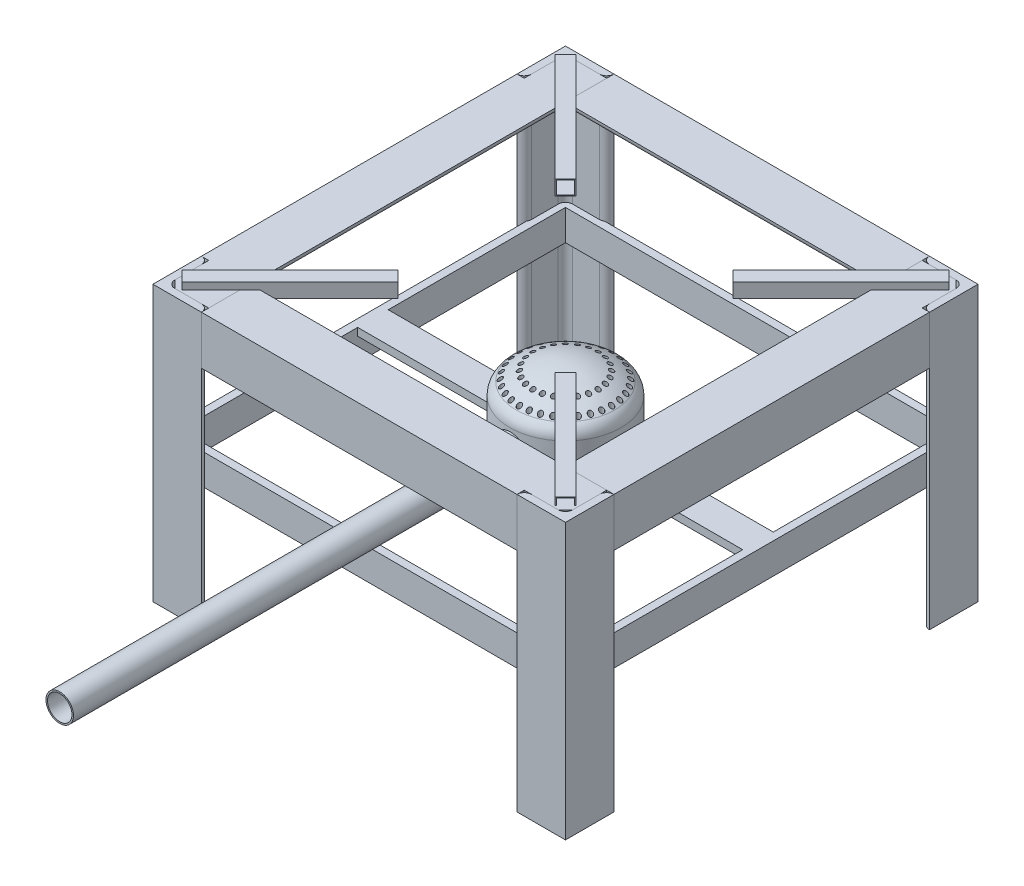
from build123d import *

# Parameters (mm, degrees)
L_START                                        = 31.75
L_ANGLE_L1_25X1_25X0_1875_1_DEPTH              = 206.5
L_START_2                                      = 238.25
L_ANGLE_L1_25X1_25X0_1875_1_2_DEPTH            = 26.9875
L_START_3                                      = 8.130096045
L_ANGLE_L1_25X1_25X0_1875_1_3_DEPTH            = 23.619903955
L_START_4                                      = 180.816042784
L_ANGLE_L1_25X1_25X0_1875_1_4_OUTLINE_W        = 10
L_ANGLE_L1_25X1_25X0_1875_1_4_OUTLINE_H        = 12
L_ANGLE_L1_25X1_25X0_1875_1_4_DEPTH            = 4.183957216
L_START_5                                      = 100.368069623
L_ANGLE_L1_25X1_25X0_1875_1_5_DEPTH            = 4.631930377
L_START_6                                      = -238.25
L_ANGLE_L1_25X1_25X0_1875_1_6_DEPTH            = 206.5
L_START_7                                      = -265.2375
L_ANGLE_L1_25X1_25X0_1875_1_7_DEPTH            = 260.475
L_START_8                                      = -185
L_ANGLE_L1_25X1_25X0_1875_1_8_OUTLINE_W        = 185.897211864
L_ANGLE_L1_25X1_25X0_1875_1_8_OUTLINE_H        = 12
L_ANGLE_L1_25X1_25X0_1875_1_8_DEPTH            = 4.183957216
L_START_9                                      = -19.083044257
L_ANGLE_L1_25X1_25X0_1875_1_9_OUTLINE_W        = 4.102788136
L_ANGLE_L1_25X1_25X0_1875_1_9_OUTLINE_H        = 12
L_ANGLE_L1_25X1_25X0_1875_1_9_DEPTH            = 38.166088514
L_ANGLE_L1_25X1_25X0_1875_1_10_DEPTH           = 206.5
L_ANGLE_L1_25X1_25X0_1875_1_11_DEPTH           = 26.9875
L_START_10                                     = -31.75
L_ANGLE_L1_25X1_25X0_1875_1_12_DEPTH           = 23.619903955
L_START_11                                     = 371.734873705
L_ANGLE_L1_25X1_25X0_1875_1_13_OUTLINE_W       = 10
L_ANGLE_L1_25X1_25X0_1875_1_13_OUTLINE_H       = 13
L_ANGLE_L1_25X1_25X0_1875_1_13_DEPTH           = 4.265126295
L_START_12                                     = 256.252642304
L_ANGLE_L1_25X1_25X0_1875_1_14_DEPTH           = 4.747357696
L_ANGLE_L1_25X1_25X0_1875_1_15_DEPTH           = 206.5
L_ANGLE_L1_25X1_25X0_1875_1_16_DEPTH           = 253.73980791
L_START_13                                     = -105
L_ANGLE_L1_25X1_25X0_1875_1_17_DEPTH           = 6
L_START_14                                     = 255
L_ANGLE_L1_25X1_25X0_1875_1_18_DEPTH           = 6
L_ANGLE_L1_25X1_25X0_1875_1_19_DEPTH           = 180
L_ANGLE_L1_25X1_25X0_1875_1_20_DEPTH           = 180
L_ANGLE_L1_25X1_25X0_1875_1_21_DEPTH           = 180
L_ANGLE_L1_25X1_25X0_1875_1_22_DEPTH           = 180
SKETCH131_W                                    = 9.525
SKETCH131_H                                    = 9.525
SKETCH131_W_2                                  = 8.4074
SKETCH131_H_2                                  = 8.4074
AL_TUBE_SQUARE_AL_TUBE_0_375_SQR_X_0_022_DEPTH = 100
SKETCH131_ON_SEGMENT_2_W                       = 9.525
SKETCH131_ON_SEGMENT_2_H                       = 9.525
SKETCH131_ON_SEGMENT_2_W_2                     = 8.4074
SKETCH131_ON_SEGMENT_2_H_2                     = 8.4074
AL_TUBE_SQUARE_AL_TUBE_0_375_SQR_X_0_2_DEPTH   = 100
SKETCH131_ON_SEGMENT_3_W                       = 9.525
SKETCH131_ON_SEGMENT_3_H                       = 9.525
SKETCH131_ON_SEGMENT_3_W_2                     = 8.4074
SKETCH131_ON_SEGMENT_3_H_2                     = 8.4074
AL_TUBE_SQUARE_AL_TUBE_0_375_SQR_X_0_3_DEPTH   = 100
SKETCH131_ON_SEGMENT_4_W                       = 9.525
SKETCH131_ON_SEGMENT_4_H                       = 9.525
SKETCH131_ON_SEGMENT_4_W_2                     = 8.4074
SKETCH131_ON_SEGMENT_4_H_2                     = 8.4074
AL_TUBE_SQUARE_AL_TUBE_0_375_SQR_X_0_4_DEPTH   = 100
SKETCH133_W                                    = 5
SKETCH133_H                                    = 20
BOSS_EXTRUDE1_DEPTH                            = 270
CIRPATTERN3_COUNT                              = 4
SKETCH135_W                                    = 20
SKETCH135_H                                    = 5
BOSS_EXTRUDE2_DEPTH                            = 260
SKETCH136_R                                    = 36.314503412
BOSS_EXTRUDE3_DEPTH                            = 24
DOME1_FACE_RADIUS                              = 36.314503412
DOME1_HEIGHT                                   = 14
FILLET1_R                                      = 10
BOSS_EXTRUDE4_START                            = -100
SKETCH137_R                                    = 9
BOSS_EXTRUDE4_DEPTH                            = 300
SHELL2_START                                   = -103
SHELL2_OUTLINE_R                               = 8
SHELL2_DEPTH                                   = 299
SKETCH138_R                                    = 1.5
CUT_EXTRUDE1_DEPTH                             = 24


with BuildPart() as part:
    # L angle L1.25X1.25X0.1875(1): read off the stored shape, not the designer's step
    # L angle L1.25X1.25X0.1875(1) outline → L angle L1.25X1.25X0.1875(1) (new body)
    with BuildSketch(Plane.YZ.offset(L_START)):
        with BuildLine():
            ThreePointArc((170.475, -4.7625), (173.842596045, -6.157403955), (175.2375, -9.525))
            Line((175.2375, -9.525), (175.2375, -26.99258))
            ThreePointArc((175.2375, -26.99258), (176.630916057, -30.356583943), (179.99492, -31.75))
            Line((179.99492, -31.75), (180, -31.75))
            Line((180, -31.75), (180, 0))
            Line((180, 0), (148.25, 0))
            Line((148.25, 0), (148.25, -0.00508))
            ThreePointArc((148.25, -0.00508), (149.643416057, -3.369083943), (153.00742, -4.7625))
            Line((153.00742, -4.7625), (170.475, -4.7625))
        make_face()
    extrude(amount=L_ANGLE_L1_25X1_25X0_1875_1_DEPTH)

    # L angle L1.25X1.25X0.1875_1 2 outline → L angle L1.25X1.25X0.1875_1 2 (add)
    with BuildSketch(Plane.YZ.offset(L_START_2)):
        with BuildLine():
            ThreePointArc((170.475, -4.7625), (173.842596045, -6.157403955), (175.2375, -9.525))
            Line((175.2375, -9.525), (175.2375, -26.99258))
            ThreePointArc((175.2375, -26.99258), (176.630916057, -30.356583943), (179.99492, -31.75))
            Line((179.99492, -31.75), (180, -31.75))
            Line((180, -31.75), (180, -4.7625))
            Line((180, -4.7625), (170.475, -4.7625))
        make_face()
    extrude(amount=L_ANGLE_L1_25X1_25X0_1875_1_2_DEPTH)

    # L angle L1.25X1.25X0.1875_1 3 outline → L angle L1.25X1.25X0.1875_1 3 (add)
    with BuildSketch(Plane.YZ.offset(L_START_3)):
        with BuildLine():
            Line((175.2375, -4.7625), (170.475, -4.7625))
            ThreePointArc((170.475, -4.7625), (173.842596045, -6.157403955), (175.2375, -9.525))
            Line((175.2375, -9.525), (175.2375, -4.7625))
        make_face()
    extrude(amount=L_ANGLE_L1_25X1_25X0_1875_1_3_DEPTH)

    # L angle L1.25X1.25X0.1875_1 4 outline → L angle L1.25X1.25X0.1875_1 4 (cut)
    with BuildSketch(Plane(origin=(0, 0, 0), x_dir=(0.707106781186552, 0, -0.7071067811865429), z_dir=(0.707106781186543, 0, 0.707106781186552)).offset(L_START_4)):
        with Locations((191, 175)):
            Rectangle(L_ANGLE_L1_25X1_25X0_1875_1_4_OUTLINE_W, L_ANGLE_L1_25X1_25X0_1875_1_4_OUTLINE_H)
    extrude(amount=L_ANGLE_L1_25X1_25X0_1875_1_4_DEPTH, mode=Mode.SUBTRACT)

    # L angle L1.25X1.25X0.1875_1 5 outline → L angle L1.25X1.25X0.1875_1 5 (cut)
    with BuildSketch(Plane(origin=(0, 0, 0), x_dir=(0.8164965809277261, -0.408248290463863, -0.408248290463863), z_dir=(0.5773502691896257, 0.5773502691896257, 0.5773502691896257)).offset(L_START_5)):
        Polygon((-59.8747149, 123.911624568), (-61.818997383, 127.279220614), (-59.8747149, 130.646816659), (-59.093454134, 132), (-64, 132), (-64, 122), (-58.771037941, 122), align=None)
    extrude(amount=L_ANGLE_L1_25X1_25X0_1875_1_5_DEPTH, mode=Mode.SUBTRACT)


with BuildPart() as body_2:
    # L angle L1.25X1.25X0.1875_1 6 outline → L angle L1.25X1.25X0.1875_1 6 (new body)
    with BuildSketch(Plane.XY.offset(L_START_6)):
        with BuildLine():
            Line((0, 180), (0, 148.25))
            Line((0, 148.25), (0.00508, 148.25))
            ThreePointArc((0.00508, 148.25), (3.369083943, 149.643416057), (4.7625, 153.00742))
            Line((4.7625, 153.00742), (4.7625, 170.475))
            ThreePointArc((4.7625, 170.475), (6.157403955, 173.842596045), (9.525, 175.2375))
            Line((9.525, 175.2375), (26.99258, 175.2375))
            ThreePointArc((26.99258, 175.2375), (30.356583943, 176.630916057), (31.75, 179.99492))
            Line((31.75, 179.99492), (31.75, 180))
            Line((31.75, 180), (0, 180))
        make_face()
    extrude(amount=L_ANGLE_L1_25X1_25X0_1875_1_6_DEPTH)

    # L angle L1.25X1.25X0.1875_1 7 outline → L angle L1.25X1.25X0.1875_1 7 (add)
    with BuildSketch(Plane.XY.offset(L_START_7)):
        with BuildLine():
            Line((31.75, 180), (4.7625, 180))
            Line((4.7625, 180), (4.7625, 170.475))
            ThreePointArc((4.7625, 170.475), (6.157403955, 173.842596045), (9.525, 175.2375))
            Line((9.525, 175.2375), (26.99258, 175.2375))
            ThreePointArc((26.99258, 175.2375), (30.356583943, 176.630916057), (31.75, 179.99492))
            Line((31.75, 179.99492), (31.75, 180))
        make_face()
    extrude(amount=L_ANGLE_L1_25X1_25X0_1875_1_7_DEPTH)

    # L angle L1.25X1.25X0.1875_1 8 outline → L angle L1.25X1.25X0.1875_1 8 (cut)
    with BuildSketch(Plane(origin=(0, 0, 0), x_dir=(0.7071067811865474, 0, -0.7071067811865477), z_dir=(0.7071067811865476, 0, 0.7071067811865476)).offset(L_START_8)):
        with Locations((103.051394068, 175)):
            Rectangle(L_ANGLE_L1_25X1_25X0_1875_1_8_OUTLINE_W, L_ANGLE_L1_25X1_25X0_1875_1_8_OUTLINE_H)
    extrude(amount=L_ANGLE_L1_25X1_25X0_1875_1_8_DEPTH, mode=Mode.SUBTRACT)

    # L angle L1.25X1.25X0.1875_1 9 outline → L angle L1.25X1.25X0.1875_1 9 (cut)
    with BuildSketch(Plane(origin=(0, 0, 0), x_dir=(0.7071067811865474, 0, -0.7071067811865477), z_dir=(0.7071067811865476, 0, 0.7071067811865476)).offset(L_START_9)):
        with Locations((8.051394068, 175)):
            Rectangle(L_ANGLE_L1_25X1_25X0_1875_1_9_OUTLINE_W, L_ANGLE_L1_25X1_25X0_1875_1_9_OUTLINE_H)
    extrude(amount=L_ANGLE_L1_25X1_25X0_1875_1_9_DEPTH, mode=Mode.SUBTRACT)


with BuildPart() as body_3:
    # L angle L1.25X1.25X0.1875_1 10 outline → L angle L1.25X1.25X0.1875_1 10 (new body)
    with BuildSketch(Plane.XY.offset(L_START_6)):
        with BuildLine():
            Line((270, 148.25), (270, 180))
            Line((270, 180), (238.25, 180))
            Line((238.25, 180), (238.25, 179.99492))
            ThreePointArc((238.25, 179.99492), (239.643416057, 176.630916057), (243.00742, 175.2375))
            Line((243.00742, 175.2375), (260.475, 175.2375))
            ThreePointArc((260.475, 175.2375), (263.842596045, 173.842596045), (265.2375, 170.475))
            Line((265.2375, 170.475), (265.2375, 153.00742))
            ThreePointArc((265.2375, 153.00742), (266.630916057, 149.643416057), (269.99492, 148.25))
            Line((269.99492, 148.25), (270, 148.25))
        make_face()
    extrude(amount=L_ANGLE_L1_25X1_25X0_1875_1_10_DEPTH)

    # L angle L1.25X1.25X0.1875_1 11 outline → L angle L1.25X1.25X0.1875_1 11 (add)
    with BuildSketch(Plane.XY.offset(L_START_7)):
        with BuildLine():
            Line((265.2375, 180), (238.25, 180))
            Line((238.25, 180), (238.25, 179.99492))
            ThreePointArc((238.25, 179.99492), (239.643416057, 176.630916057), (243.00742, 175.2375))
            Line((243.00742, 175.2375), (260.475, 175.2375))
            ThreePointArc((260.475, 175.2375), (263.842596045, 173.842596045), (265.2375, 170.475))
            Line((265.2375, 170.475), (265.2375, 180))
        make_face()
    extrude(amount=L_ANGLE_L1_25X1_25X0_1875_1_11_DEPTH)

    # L angle L1.25X1.25X0.1875_1 12 outline → L angle L1.25X1.25X0.1875_1 12 (add)
    with BuildSketch(Plane.XY.offset(L_START_10)):
        with BuildLine():
            Line((265.2375, 170.475), (265.2375, 175.2375))
            Line((265.2375, 175.2375), (260.475, 175.2375))
            ThreePointArc((260.475, 175.2375), (263.842596045, 173.842596045), (265.2375, 170.475))
        make_face()
    extrude(amount=L_ANGLE_L1_25X1_25X0_1875_1_12_DEPTH)

    # L angle L1.25X1.25X0.1875_1 13 outline → L angle L1.25X1.25X0.1875_1 13 (cut)
    with BuildSketch(Plane(origin=(0, 0, 0), x_dir=(0.707106781186545, 0, 0.70710678118655), z_dir=(0.70710678118655, 0, -0.707106781186545)).offset(L_START_11)):
        with Locations((0, -175.5)):
            Rectangle(L_ANGLE_L1_25X1_25X0_1875_1_13_OUTLINE_W, L_ANGLE_L1_25X1_25X0_1875_1_13_OUTLINE_H)
    extrude(amount=L_ANGLE_L1_25X1_25X0_1875_1_13_DEPTH, mode=Mode.SUBTRACT)

    # L angle L1.25X1.25X0.1875_1 14 outline → L angle L1.25X1.25X0.1875_1 14 (cut)
    with BuildSketch(Plane(origin=(0, 0, 0), x_dir=(0.8164965809277256, -0.40824829046386785, 0.4082482904638592), z_dir=(0.5773502691896265, 0.5773502691896314, -0.5773502691896192)).offset(L_START_12)):
        Polygon((143.0808196, -113.808836432), (141.136537117, -117.176432477), (136, -117.176432477), (136, -120), (145, -120), (145, -112), (144.125151801, -112), align=None)
    extrude(amount=L_ANGLE_L1_25X1_25X0_1875_1_14_DEPTH, mode=Mode.SUBTRACT)


with BuildPart() as body_4:
    # L angle L1.25X1.25X0.1875_1 15 outline → L angle L1.25X1.25X0.1875_1 15 (new body)
    with BuildSketch(Plane.YZ.offset(L_START)):
        with BuildLine():
            Line((148.25, -270), (180, -270))
            Line((180, -270), (180, -238.25))
            Line((180, -238.25), (179.99492, -238.25))
            ThreePointArc((179.99492, -238.25), (176.630916057, -239.643416057), (175.2375, -243.00742))
            Line((175.2375, -243.00742), (175.2375, -260.475))
            ThreePointArc((175.2375, -260.475), (173.842596045, -263.842596045), (170.475, -265.2375))
            Line((170.475, -265.2375), (153.00742, -265.2375))
            ThreePointArc((153.00742, -265.2375), (149.643416057, -266.630916057), (148.25, -269.99492))
            Line((148.25, -269.99492), (148.25, -270))
        make_face()
    extrude(amount=L_ANGLE_L1_25X1_25X0_1875_1_15_DEPTH)

    # L angle L1.25X1.25X0.1875_1 16 outline → L angle L1.25X1.25X0.1875_1 16 (add)
    with BuildSketch(Plane.YZ.offset(L_START_3)):
        with BuildLine():
            ThreePointArc((175.2375, -260.475), (173.842596045, -263.842596045), (170.475, -265.2375))
            Line((170.475, -265.2375), (175.2375, -265.2375))
            Line((175.2375, -265.2375), (175.2375, -260.475))
        make_face()
    extrude(amount=L_ANGLE_L1_25X1_25X0_1875_1_16_DEPTH)

    # L angle L1.25X1.25X0.1875_1 17 outline → L angle L1.25X1.25X0.1875_1 17 (cut)
    with BuildSketch(Plane(origin=(0, 0, 0), x_dir=(0.8164965809277253, 0.4082482904638598, -0.40824829046386774), z_dir=(0.5773502691896268, -0.5773502691896195, 0.5773502691896308)).offset(L_START_13)):
        Polygon((389.8214324, -59), (390.555830176, -60.272014261), (392.500112659, -63.639610307), (390.555830176, -67.007206352), (389.405290227, -69), (395, -69), (395, -59), align=None)
    extrude(amount=L_ANGLE_L1_25X1_25X0_1875_1_17_DEPTH, mode=Mode.SUBTRACT)

    # L angle L1.25X1.25X0.1875_1 18 outline → L angle L1.25X1.25X0.1875_1 18 (cut)
    with BuildSketch(Plane(origin=(0, 0, 0), x_dir=(0.8164965809277261, -0.408248290463863, 0.408248290463863), z_dir=(0.5773502691896257, 0.5773502691896257, -0.5773502691896257)).offset(L_START_14)):
        Polygon((-169.367355549, 59), (-170.101753325, 60.272014261), (-172.046035809, 63.639610307), (-170.101753325, 67.007206352), (-169, 68.915499087), (-169, 69), (-175, 69), (-175, 59), align=None)
    extrude(amount=L_ANGLE_L1_25X1_25X0_1875_1_18_DEPTH, mode=Mode.SUBTRACT)


with BuildPart() as body_5:
    # L angle L1.25X1.25X0.1875_1 19 outline → L angle L1.25X1.25X0.1875_1 19 (new body)
    with BuildSketch(Plane(origin=(0, 0, 0), x_dir=(1, 0, 0), z_dir=(0, 1, 0))):
        with BuildLine():
            Line((270, 238.25), (270, 270))
            Line((270, 270), (238.25, 270))
            Line((238.25, 270), (238.25, 269.99492))
            ThreePointArc((238.25, 269.99492), (239.643416057, 266.630916057), (243.00742, 265.2375))
            Line((243.00742, 265.2375), (260.475, 265.2375))
            ThreePointArc((260.475, 265.2375), (263.842596045, 263.842596045), (265.2375, 260.475))
            Line((265.2375, 260.475), (265.2375, 243.00742))
            ThreePointArc((265.2375, 243.00742), (266.630916057, 239.643416057), (269.99492, 238.25))
            Line((269.99492, 238.25), (270, 238.25))
        make_face()
    extrude(amount=L_ANGLE_L1_25X1_25X0_1875_1_19_DEPTH)


with BuildPart() as body_6:
    # L angle L1.25X1.25X0.1875_1 20 outline → L angle L1.25X1.25X0.1875_1 20 (new body)
    with BuildSketch(Plane(origin=(0, 0, 0), x_dir=(1, 0, 0), z_dir=(0, 1, 0))):
        with BuildLine():
            Line((31.75, 270), (0, 270))
            Line((0, 270), (0, 238.25))
            Line((0, 238.25), (0.00508, 238.25))
            ThreePointArc((0.00508, 238.25), (3.369083943, 239.643416057), (4.7625, 243.00742))
            Line((4.7625, 243.00742), (4.7625, 260.475))
            ThreePointArc((4.7625, 260.475), (6.157403955, 263.842596045), (9.525, 265.2375))
            Line((9.525, 265.2375), (26.99258, 265.2375))
            ThreePointArc((26.99258, 265.2375), (30.356583943, 266.630916057), (31.75, 269.99492))
            Line((31.75, 269.99492), (31.75, 270))
        make_face()
    extrude(amount=L_ANGLE_L1_25X1_25X0_1875_1_20_DEPTH)


with BuildPart() as body_7:
    # L angle L1.25X1.25X0.1875_1 21 outline → L angle L1.25X1.25X0.1875_1 21 (new body)
    with BuildSketch(Plane(origin=(0, 0, 0), x_dir=(1, 0, 0), z_dir=(0, 1, 0))):
        with BuildLine():
            Line((0, 0), (31.75, 0))
            Line((31.75, 0), (31.75, 0.00508))
            ThreePointArc((31.75, 0.00508), (30.356583943, 3.369083943), (26.99258, 4.7625))
            Line((26.99258, 4.7625), (9.525, 4.7625))
            ThreePointArc((9.525, 4.7625), (6.157403955, 6.157403955), (4.7625, 9.525))
            Line((4.7625, 9.525), (4.7625, 26.99258))
            ThreePointArc((4.7625, 26.99258), (3.369083943, 30.356583943), (0.00508, 31.75))
            Line((0.00508, 31.75), (0, 31.75))
            Line((0, 31.75), (0, 0))
        make_face()
    extrude(amount=L_ANGLE_L1_25X1_25X0_1875_1_21_DEPTH)



with BuildPart() as body_8:
    # L angle L1.25X1.25X0.1875_1 22 outline → L angle L1.25X1.25X0.1875_1 22 (new body)
    with BuildSketch(Plane(origin=(0, 0, 0), x_dir=(1, 0, 0), z_dir=(0, 1, 0))):
        with BuildLine():
            Line((238.25, 0), (270, 0))
            Line((270, 0), (270, 31.75))
            Line((270, 31.75), (269.99492, 31.75))
            ThreePointArc((269.99492, 31.75), (266.630916057, 30.356583943), (265.2375, 26.99258))
            Line((265.2375, 26.99258), (265.2375, 9.525))
            ThreePointArc((265.2375, 9.525), (263.842596045, 6.157403955), (260.475, 4.7625))
            Line((260.475, 4.7625), (243.00742, 4.7625))
            ThreePointArc((243.00742, 4.7625), (239.643416057, 3.369083943), (238.25, 0.00508))
            Line((238.25, 0.00508), (238.25, 0))
        make_face()
    extrude(amount=L_ANGLE_L1_25X1_25X0_1875_1_22_DEPTH)


with BuildPart() as body_9:
    # Sketch131 → Al tube square AL TUBE 0.375 SQR X 0.022 WALL(1) (new body)
    with BuildSketch(Plane(origin=(9.525, 180, -260.475), x_dir=(0.7071067811865434, 7.773490963901416e-15, -0.7071067811865518), z_dir=(0.7071067811865518, -7.770424377067959e-15, 0.7071067811865434))):
        Rectangle(SKETCH131_W, SKETCH131_H)
        Rectangle(SKETCH131_W_2, SKETCH131_H_2, mode=Mode.SUBTRACT)
    extrude(amount=AL_TUBE_SQUARE_AL_TUBE_0_375_SQR_X_0_022_DEPTH)


with BuildPart() as body_10:
    # Sketch131 on segment 2 (carried to segment 2) → Al tube square AL TUBE 0.375 SQR X 0 2 (new body)
    with BuildSketch(Plane(origin=(189.764321881, 180, -80.235678119), x_dir=(0.707106781, 0, -0.707106781), z_dir=(0.707106781, 0, 0.707106781))):
        Rectangle(SKETCH131_ON_SEGMENT_2_W, SKETCH131_ON_SEGMENT_2_H)
        Rectangle(SKETCH131_ON_SEGMENT_2_W_2, SKETCH131_ON_SEGMENT_2_H_2, mode=Mode.SUBTRACT)
    extrude(amount=AL_TUBE_SQUARE_AL_TUBE_0_375_SQR_X_0_2_DEPTH)


with BuildPart() as body_11:
    # Sketch131 on segment 3 (carried to segment 3) → Al tube square AL TUBE 0.375 SQR X 0 3 (new body)
    with BuildSketch(Plane(origin=(9.525, 180, -9.525), x_dir=(-0.707106781, 0, -0.707106781), z_dir=(0.707106781, 0, -0.707106781))):
        Rectangle(SKETCH131_ON_SEGMENT_3_W, SKETCH131_ON_SEGMENT_3_H)
        Rectangle(SKETCH131_ON_SEGMENT_3_W_2, SKETCH131_ON_SEGMENT_3_H_2, mode=Mode.SUBTRACT)
    extrude(amount=AL_TUBE_SQUARE_AL_TUBE_0_375_SQR_X_0_3_DEPTH)


with BuildPart() as body_12:
    # Sketch131 on segment 4 (carried to segment 4) → Al tube square AL TUBE 0.375 SQR X 0 4 (new body)
    with BuildSketch(Plane(origin=(260.475, 180, -260.475), x_dir=(0.707106781, 0, 0.707106781), z_dir=(-0.707106781, 0, 0.707106781))):
        Rectangle(SKETCH131_ON_SEGMENT_4_W, SKETCH131_ON_SEGMENT_4_H)
        Rectangle(SKETCH131_ON_SEGMENT_4_W_2, SKETCH131_ON_SEGMENT_4_H_2, mode=Mode.SUBTRACT)
    extrude(amount=AL_TUBE_SQUARE_AL_TUBE_0_375_SQR_X_0_4_DEPTH)


with BuildPart() as body_7_1:
    add(body_7.part)

    add(body_8.part)  # Boss-Extrude1 merges body 8
    # Sketch133 → Boss-Extrude1 (add)
    with BuildSketch(Plane(origin=(0, 0, 0), x_dir=(0, 0, -1), z_dir=(1, 0, 0))):
        with Locations((6.5, 87.521888974)):
            Rectangle(SKETCH133_W, SKETCH133_H)
    boss_extrude1 = extrude(amount=BOSS_EXTRUDE1_DEPTH)

    # CirPattern3: Boss-Extrude1 ×4 about axis
    cirpattern3_axis = Axis((135, 0, -135), (0, 1, 0))
    for i in range(1, CIRPATTERN3_COUNT):
        add(boss_extrude1.rotate(cirpattern3_axis, i * 360 / CIRPATTERN3_COUNT))

    # Sketch135 → Boss-Extrude2 (add)
    with BuildSketch(Plane(origin=(266, 0, 0), x_dir=(0, 0, -1), z_dir=(1, 0, 0))):
        with Locations((135, 95.021888974)):
            Rectangle(SKETCH135_W, SKETCH135_H)
    extrude(amount=-BOSS_EXTRUDE2_DEPTH)


with BuildPart() as body_12_2:
    # Sketch136 → Boss-Extrude3 (new body)
    with BuildSketch(Plane(origin=(0, 97.521888974, 0), x_dir=(1, 0, 0), z_dir=(0, 1, 0))):
        with Locations(Location((135, 135, 0), (0, 0, 270))):
            Circle(SKETCH136_R)
    extrude(amount=BOSS_EXTRUDE3_DEPTH)

    # Dome1: a dome of height H over a round flat face of radius A is a cap of a sphere of radius (A * A + H * H) / (2 * H)
    dome1_r = (DOME1_FACE_RADIUS * DOME1_FACE_RADIUS + DOME1_HEIGHT * DOME1_HEIGHT) / (2 * DOME1_HEIGHT)
    dome1_base = Plane((135, 121.521888974, -135), z_dir=(0, 1, 0))
    with Locations(dome1_base.offset(DOME1_HEIGHT - dome1_r)):
        dome1_ball = Sphere(dome1_r, mode=Mode.PRIVATE)
    add(split(dome1_ball, bisect_by=dome1_base, keep=Keep.TOP, mode=Mode.PRIVATE))

    # Fillet1
    fillet1_edges = [body_12_2.edges().sort_by_distance(p)[0] for p in [
        (135, 121.521888974, -171.314503412),
    ]]
    fillet(fillet1_edges, radius=FILLET1_R)

    # Shell1: read off the stored shape, not the designer's step
    # Shell1 outline → Shell1 (revolve, cut)
    with BuildSketch(Plane(origin=(135, 0, -135), x_dir=(1, 0, 0), z_dir=(0, 0, 1))):
        with BuildLine():
            Line((31.314503412, 97.521888974), (31.314503412, 116.810044322))
            ThreePointArc((31.314503412, 116.810044322), (30.782064585, 119.055238559), (29.298144547, 120.822261362))
            ThreePointArc((29.298144547, 120.822261362), (15.43100817, 128.033946271), (0, 130.521888974))
            Line((0, 130.521888974), (0, 97.521888974))
            Line((0, 97.521888974), (31.314503412, 97.521888974))
        make_face()
    revolve(axis=Axis((135, 0, -135), (0, 1, 0)), mode=Mode.SUBTRACT)

    # Sketch138 → Cut-Extrude1 (cut)
    with BuildSketch(Plane(origin=(0, 140, 0), x_dir=(1, 0, 0), z_dir=(0, 1, 0))):
        with Locations(Location((135, 165.191782037, 0), (0, 0, 217.718514705))):
            Circle(SKETCH138_R)
        with Locations(Location((140.89012448, 164.611655411, 0), (0, 0, 311.031485402))):
            Circle(SKETCH138_R)
        with Locations(Location((146.553894779, 162.893569474, 0), (0, 0, 299.781485402))):
            Circle(SKETCH138_R)
        with Locations(Location((151.773655382, 160.103549305, 0), (0, 0, 288.531485401))):
            Circle(SKETCH138_R)
        with Locations(Location((156.348813815, 156.348813815, 0), (0, 0, 277.281485401))):
            Circle(SKETCH138_R)
        with Locations(Location((160.103549305, 151.773655382, 0), (0, 0, 266.031485401))):
            Circle(SKETCH138_R)
        with Locations(Location((162.893569474, 146.553894779, 0), (0, 0, 254.781485401))):
            Circle(SKETCH138_R)
        with Locations(Location((164.611655411, 140.89012448, 0), (0, 0, 243.531485401))):
            Circle(SKETCH138_R)
        with Locations(Location((165.191782037, 135, 0), (0, 0, 232.281485401))):
            Circle(SKETCH138_R)
        with Locations(Location((164.611655411, 129.10987552, 0), (0, 0, 306.273667706))):
            Circle(SKETCH138_R)
        with Locations(Location((162.893569474, 123.446105221, 0), (0, 0, 295.023667706))):
            Circle(SKETCH138_R)
        with Locations(Location((160.103549305, 118.226344618, 0), (0, 0, 283.773667706))):
            Circle(SKETCH138_R)
        with Locations(Location((156.348813815, 113.651186185, 0), (0, 0, 272.523667706))):
            Circle(SKETCH138_R)
        with Locations(Location((151.773655382, 109.896450695, 0), (0, 0, 261.273670441))):
            Circle(SKETCH138_R)
        with Locations(Location((146.553894779, 107.106430526, 0), (0, 0, 250.023670442))):
            Circle(SKETCH138_R)
        with Locations(Location((140.89012448, 105.388344589, 0), (0, 0, 238.773670442))):
            Circle(SKETCH138_R)
        with Locations(Location((135, 104.808217963, 0), (0, 0, 227.523670442))):
            Circle(SKETCH138_R)
        with Locations(Location((129.10987552, 105.388344589, 0), (0, 0, 301.226332293))):
            Circle(SKETCH138_R)
        with Locations(Location((123.446105221, 107.106430526, 0), (0, 0, 289.976332293))):
            Circle(SKETCH138_R)
        with Locations(Location((118.226344618, 109.896450695, 0), (0, 0, 278.726332293))):
            Circle(SKETCH138_R)
        with Locations(Location((113.651186186, 113.651186185, 0), (0, 0, 267.476332293))):
            Circle(SKETCH138_R)
        with Locations(Location((109.896450695, 118.226344618, 0), (0, 0, 256.226332293))):
            Circle(SKETCH138_R)
        with Locations(Location((107.106430526, 123.446105221, 0), (0, 0, 244.976332293))):
            Circle(SKETCH138_R)
        with Locations(Location((105.388344589, 129.10987552, 0), (0, 0, 233.726332293))):
            Circle(SKETCH138_R)
        with Locations(Location((104.808217963, 135, 0), (0, 0, 307.718514704))):
            Circle(SKETCH138_R)
        with Locations(Location((105.388344589, 140.89012448, 0), (0, 0, 296.46851459))):
            Circle(SKETCH138_R)
        with Locations(Location((107.106430526, 146.553894779, 0), (0, 0, 285.218514704))):
            Circle(SKETCH138_R)
        with Locations(Location((109.896450695, 151.773655382, 0), (0, 0, 273.968514704))):
            Circle(SKETCH138_R)
        with Locations(Location((113.651186185, 156.348813815, 0), (0, 0, 262.718514704))):
            Circle(SKETCH138_R)
        with Locations(Location((118.226344618, 160.103549305, 0), (0, 0, 251.468514704))):
            Circle(SKETCH138_R)
        with Locations(Location((123.446105221, 162.893569474, 0), (0, 0, 240.218514704))):
            Circle(SKETCH138_R)
        with Locations(Location((129.10987552, 164.611655411, 0), (0, 0, 228.968514705))):
            Circle(SKETCH138_R)
        with Locations(Location((135, 156.348813815, 0), (0, 0, 137.078580874))):
            Circle(SKETCH138_R)
        with Locations(Location((140.525479606, 155.621370624, 0), (0, 0, 135.761086643))):
            Circle(SKETCH138_R)
        with Locations(Location((145.674406907, 153.488615104, 0), (0, 0, 133.751534731))):
            Circle(SKETCH138_R)
        with Locations(Location((150.095891019, 150.095891019, 0), (0, 0, 45))):
            Circle(SKETCH138_R)
        with Locations(Location((153.488615104, 145.674406907, 0), (0, 0, 129.204593114))):
            Circle(SKETCH138_R)
        with Locations(Location((155.621370624, 140.525479606, 0), (0, 0, 127.666137435))):
            Circle(SKETCH138_R)
        with Locations(Location((156.348813815, 135, 0), (0, 0, 127.306409248))):
            Circle(SKETCH138_R)
        with Locations(Location((155.621370624, 129.474520394, 0), (0, 0, 260.5992138))):
            Circle(SKETCH138_R)
        with Locations(Location((153.488615104, 124.325593093, 0), (0, 0, 131.174474568))):
            Circle(SKETCH138_R)
        with Locations(Location((150.095891019, 119.904108981, 0), (0, 0, 322.96821495))):
            Circle(SKETCH138_R)
        with Locations(Location((145.674406907, 116.511384896, 0), (0, 0, 208.940352944))):
            Circle(SKETCH138_R)
        with Locations(Location((140.525479606, 114.378629376, 0), (0, 0, 166.267612762))):
            Circle(SKETCH138_R)
        with Locations(Location((135, 113.651186185, 0), (0, 0, 173.13547563))):
            Circle(SKETCH138_R)
        with Locations(Location((129.474520394, 114.378629376, 0), (0, 0, 157.874392293))):
            Circle(SKETCH138_R)
        with Locations(Location((124.325593093, 116.511384896, 0), (0, 0, 146.030558647))):
            Circle(SKETCH138_R)
        with Locations(Location((119.904108981, 119.904108981, 0), (0, 0, 225))):
            Circle(SKETCH138_R)
        with Locations(Location((116.511384896, 124.325593093, 0), (0, 0, 149.44715518))):
            Circle(SKETCH138_R)
        with Locations(Location((114.378629376, 129.474520394, 0), (0, 0, 128.250714755))):
            Circle(SKETCH138_R)
        with Locations(Location((113.651186185, 135, 0), (0, 0, 135.362318309))):
            Circle(SKETCH138_R)
        with Locations(Location((114.378629376, 140.525479606, 0), (0, 0, 123.672669268))):
            Circle(SKETCH138_R)
        with Locations(Location((116.511384896, 145.674406907, 0), (0, 0, 134.288276876))):
            Circle(SKETCH138_R)
        with Locations(Location((119.904108981, 150.095891019, 0), (0, 0, 146.926464217))):
            Circle(SKETCH138_R)
        with Locations(Location((124.325593093, 153.488615104, 0), (0, 0, 136.482454115))):
            Circle(SKETCH138_R)
        with Locations(Location((129.474520394, 155.621370624, 0), (0, 0, 137.270801412))):
            Circle(SKETCH138_R)
    extrude(amount=-CUT_EXTRUDE1_DEPTH, mode=Mode.SUBTRACT)


with BuildPart() as body_13:
    # Sketch137 → Boss-Extrude4 (new body)
    with BuildSketch(Plane.XY.offset(-4).offset(BOSS_EXTRUDE4_START)):
        with Locations((135, 105.521888974)):
            Circle(SKETCH137_R)
    extrude(amount=BOSS_EXTRUDE4_DEPTH)

    # Shell2: read off the stored shape, not the designer's step
    # Shell2 outline → Shell2 (cut)
    with BuildSketch(Plane.XY.offset(SHELL2_START)):
        with Locations((135, 105.521888974)):
            Circle(SHELL2_OUTLINE_R)
    extrude(amount=SHELL2_DEPTH, mode=Mode.SUBTRACT)


solid = Compound([part.part, body_2.part, body_3.part, body_4.part, body_5.part, body_6.part, body_9.part, body_10.part, body_11.part, body_12.part, body_7_1.part, body_12_2.part, body_13.part])
